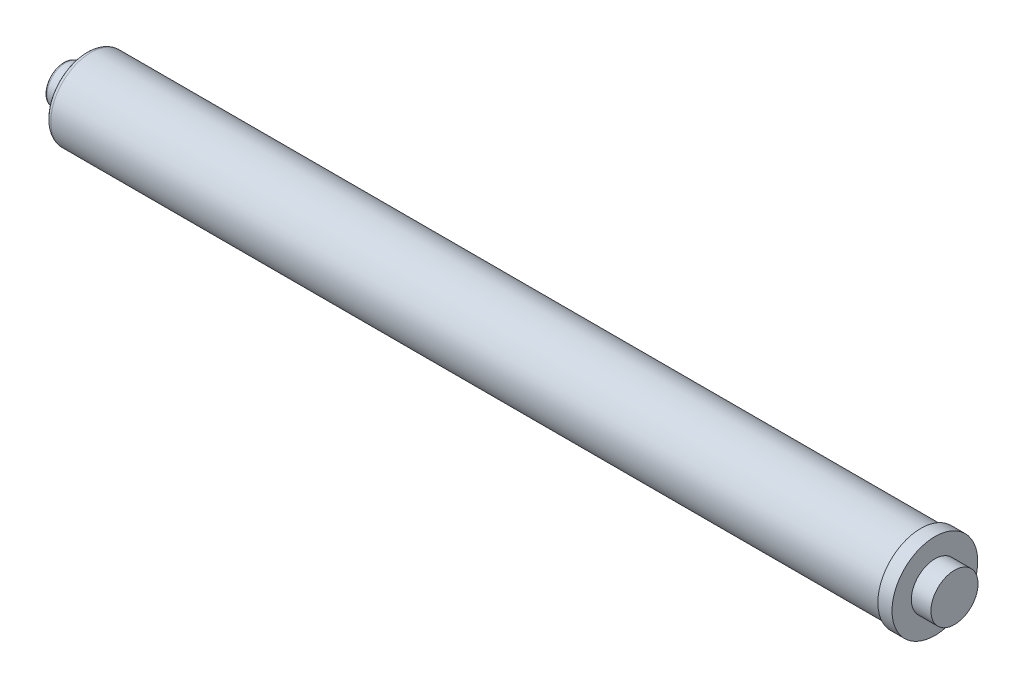
from build123d import *


with BuildPart() as part:
    # Sketch1 → Revolve1 (revolve)
    with BuildSketch(Plane(origin=(0, 0, 0), x_dir=(1, 0, 0), z_dir=(0, 1, 0))):
        with BuildLine():
            Line((-296.418, 11.1125), (-296.418, 0))
            Line((-296.418, 0), (303.911, 0))
            Line((303.911, 0), (303.911, 15.875))
            Line((303.911, 15.875), (290.703, 15.875))
            Line((290.703, 15.875), (290.703, 28.8925))
            Line((290.703, 28.8925), (281.178, 28.8925))
            Line((281.178, 28.8925), (281.178, 26.9875))
            Line((281.178, 26.9875), (-278.003, 26.9875))
            ThreePointArc((-278.003, 26.9875), (-280.24806403, 26.05756403), (-281.178, 23.8125))
            Line((-281.178, 23.8125), (-281.178, 12.7))
            Line((-281.178, 12.7), (-294.8305, 12.7))
            ThreePointArc((-294.8305, 12.7), (-295.953032015, 12.235032015), (-296.418, 11.1125))
        make_face()
    revolve(axis=Axis((-319.562207996, 0, 0), (1, 0, 0)))


solid = part.part
